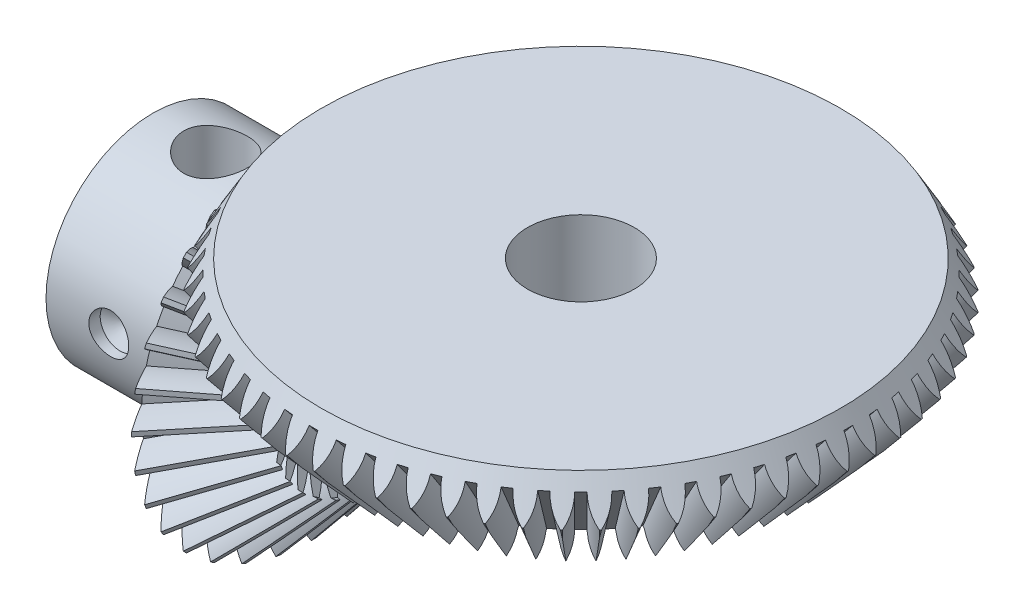
from build123d import *
from build123d.topology import SkipClean

# Parameters (mm, degrees)
CUT_EXTRUDE3_TEETH_START = -10
CUT_EXTRUDE3_TEETH_DEPTH = 38.647533478
CIRPATTERN1_COUNT        = 64
EXTRUDE1_TEETH_START     = -5.842
EXTRUDE1_TEETH_DEPTH     = 8.382
CIRPATTERN2_COUNT        = 32
SKETCH14_R               = 6.488163514
CUT_EXTRUDE1_DEPTH       = 5.588


with BuildPart() as part:
    # Sketch2 → Revolve1-LargestGear (revolve)
    with BuildSketch(Plane.XY, mode=Mode.PRIVATE) as revolve1_largestgear_sk:
        Polygon((-4.7625, 14.2748), (-2.37871, 14.2748), (-2.37871, 4.6228), (-9.216570266, 4.6228), (-9.754398022, 3.691255), (-12.51246088, 7.04215), (-11.56292176, 8.6868), (-4.7625, 8.6868), align=None)
    revolve(revolve1_largestgear_sk.sketch.rotate(Axis((0, 19.942137253, 0), (0, -1, 0)), 270), axis=Axis((0, 19.942137253, 0), (0, -1, 0)))

    # Sketch3 → Cut-Extrude3-Teeth (cut)
    with BuildSketch(Plane(origin=(-9.754398022, 3.691255, 0), x_dir=(0.7720995567395803, 0.6355015928245529, 0), z_dir=(0.6355015928245528, -0.7720995567395802, 0)).offset(CUT_EXTRUDE3_TEETH_START)):
        with BuildLine():
            ThreePointArc((-0.230362252, 0.797410795), (0.396516362, 0.357870894), (1.144573155, 0.194827479))
            ThreePointArc((1.144573155, 0.194827479), (1.143, 0), (1.144573155, -0.194827479))
            ThreePointArc((1.144573155, -0.194827479), (0.396516362, -0.357870894), (-0.230362252, -0.797410795))
            ThreePointArc((-0.230362252, -0.797410795), (-0.254, 0), (-0.230362252, 0.797410795))
        make_face()
    cut_extrude3_teeth = extrude(amount=CUT_EXTRUDE3_TEETH_DEPTH, mode=Mode.SUBTRACT)

    # CirPattern1: Cut-Extrude3-Teeth ×64 about axis
    cirpattern1_axis = Axis((0, 19.942137253, 0), (0, -1, 0))
    for i in range(1, CIRPATTERN1_COUNT):
        add(cut_extrude3_teeth.rotate(cirpattern1_axis, i * 360 / CIRPATTERN1_COUNT), mode=Mode.SUBTRACT)

    # Sketch14 → Cut-Extrude1 (cut)
    with BuildSketch(Plane(origin=(0, 14.2748, 0), x_dir=(-1, 0, 0), z_dir=(0, 1, 0))):
        Circle(SKETCH14_R)
    extrude(amount=-CUT_EXTRUDE1_DEPTH, mode=Mode.SUBTRACT)


with BuildPart() as body_2:
    # Sketch4 → Revolve2-SmallestGear (revolve)
    with BuildSketch(Plane.XY, mode=Mode.PRIVATE) as revolve2_smallestgear_sk:
        Polygon((-12.51246088, 7.04215), (-9.754398022, 3.691255), (-10.292225779, 2.75971), (-10.292225779, 2.37871), (-19.05, 2.37871), (-19.05, 4.7625), (-13.462, 4.7625), (-13.462, 5.3975), align=None)
    revolve(revolve2_smallestgear_sk.sketch.rotate(Axis((-20.225417933, 0, 0), (1, 0, 0)), 90), axis=Axis((-20.225417933, 0, 0), (1, 0, 0)))

    # Sketch5 → Extrude1-Teeth (add)
    with BuildSketch(Plane(origin=(-9.754398022, 3.691255, 0), x_dir=(0.7720995567395803, 0.6355015928245529, 0), z_dir=(0.6355015928245528, -0.7720995567395802, 0)).offset(EXTRUDE1_TEETH_START)):
        with BuildLine():
            ThreePointArc((-1.249381011, 0), (-0.065317385, 0.331265488), (1.142572203, 0.1016))
            ThreePointArc((1.142572203, 0.1016), (1.143, 0), (1.142572203, -0.1016))
            ThreePointArc((1.142572203, -0.1016), (-0.065317385, -0.331265488), (-1.249381011, 0))
        make_face()
    extrude1_teeth = extrude(amount=EXTRUDE1_TEETH_DEPTH)

    # CirPattern2: Extrude1-Teeth ×32 about axis
    cirpattern2_axis = Axis((0, 0, 0), (1, 0, 0))
    for i in range(1, CIRPATTERN2_COUNT):
        add(extrude1_teeth.rotate(cirpattern2_axis, i * 360 / CIRPATTERN2_COUNT))

    # Sketch6 → Cut-Revolve1 (revolve, cut)
    with SkipClean():  # the faces are left unmerged after this step: merging them gives an invalid solid
        with BuildSketch(Plane.XY, mode=Mode.PRIVATE) as cut_revolve1_sk:
            Polygon((-13.462, 4.7625), (-13.462, 5.3975), (-11.56292176, 8.6868), (-4.7625, 8.6868), (-4.7625, 11.4808), (-19.05, 11.4808), (-19.05, 4.7625), align=None)
            Polygon((-19.05, 2.37871), (-19.05, 0), (0, 0), (0, 4.6228), (-9.216570266, 4.6228), (-10.292225779, 2.75971), (-10.292225779, 2.37871), align=None)
        revolve(cut_revolve1_sk.sketch.rotate(Axis((-20.225417933, 0, 0), (1, 0, 0)), 270.718739172), axis=Axis((-20.225417933, 0, 0), (1, 0, 0)), mode=Mode.SUBTRACT)

    # Sketch10 → #4-40 Tapped Hole1 (revolve, cut)
    with SkipClean():  # the faces are left unmerged after this step: merging them gives an invalid solid
        with BuildSketch(Plane(origin=(-16.256, 4.7625, 0), x_dir=(0, 0, 1), z_dir=(1, 0, 0))):
            Polygon((0, 0), (0, 4.489152758), (1.1303, 3.81), (1.1303, 3.175), (1.4224, 3.175), (1.4224, 0), align=None)
        revolve(axis=Axis((-16.256, 11.1125, 0), (0, -1, 0)), mode=Mode.SUBTRACT)

    # Sketch12 → #50 (0.07) Diameter Hole1 (revolve, cut)
    with SkipClean():  # the faces are left unmerged after this step: merging them gives an invalid solid
        with BuildSketch(Plane(origin=(-16.256, 0, 4.7625), x_dir=(0, -1, 0), z_dir=(1, 0, 0))):
            Polygon((0, 0), (0, 1.04216509), (0.889, 0.508), (0.889, 0), align=None)
        revolve(axis=Axis((-16.256, 0, 11.1125), (0, 0, -1)), mode=Mode.SUBTRACT)


solid = Compound([part.part, body_2.part])
